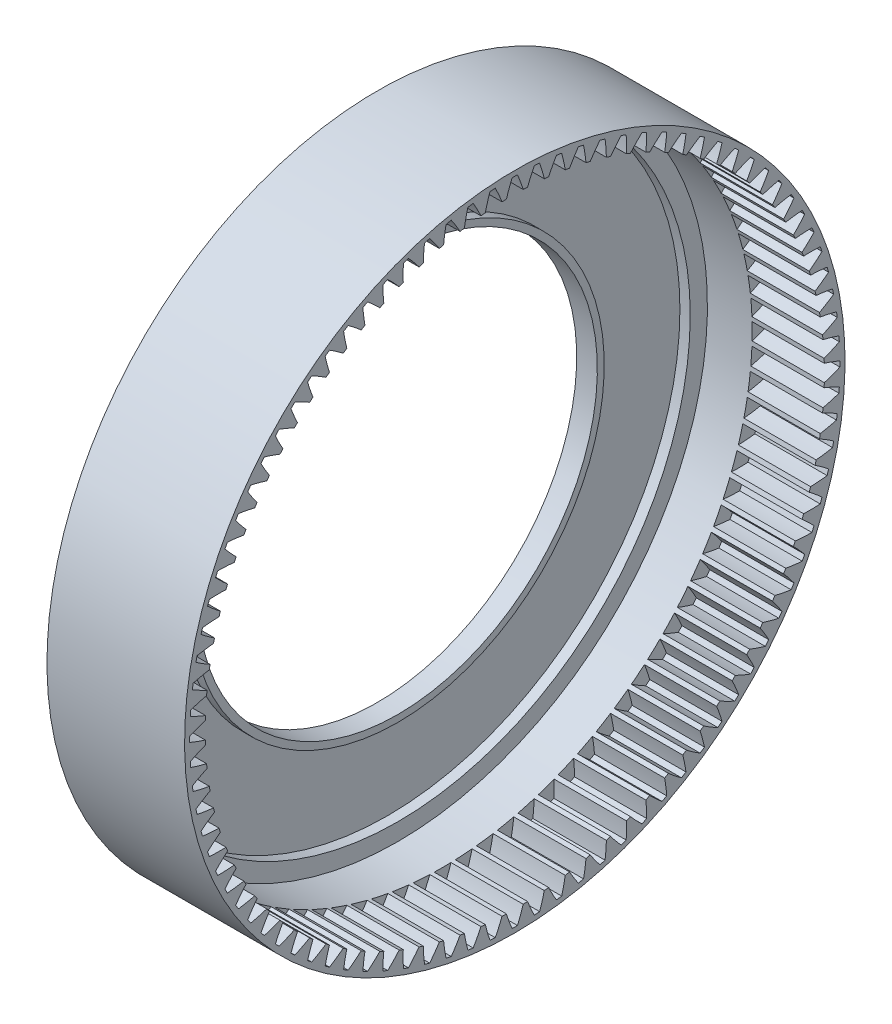
from build123d import *

# Parameters (mm, degrees)
SKETCH1_W                 = 20
SKETCH1_H                 = 48
CUT_EXTRUDE1_DEPTH        = 17
M52_CLEARANCE_HOLE1_D     = 58
M52_CLEARANCE_HOLE1_DEPTH = 20
SKETCH5_R                 = 42.5
SKETCH5_R_2               = 30
CUT_EXTRUDE3_DEPTH        = 1.5
BOSS_EXTRUDE2_START       = 6.5
SKETCH7_R                 = 48
SKETCH7_R_2               = 45
BOSS_EXTRUDE2_DEPTH       = 6.5


with BuildPart() as part:
    # Sketch1 → Revolve1 (revolve)
    with BuildSketch(Plane(origin=(0, 0, 0), x_dir=(-1, 0, 0), z_dir=(0, 0, -1)), mode=Mode.PRIVATE) as revolve1_sk:
        with Locations((-10, 24)):
            Rectangle(SKETCH1_W, SKETCH1_H)
    revolve(revolve1_sk.sketch.rotate(Axis((20, 0, 0), (-1, 0, 0)), 180), axis=Axis((20, 0, 0), (-1, 0, 0)))

    # Sketch2 → Cut-Extrude1 (cut)
    with BuildSketch(Plane(origin=(20, 0, 0), x_dir=(0, 0, -1), z_dir=(1, 0, 0))):
        with BuildLine():
            ThreePointArc((-4.920240464, -44.730204938), (-4.601886702, -44.764077549), (-4.283300013, -44.795684401))
            ThreePointArc((-4.283300013, -44.795684401), (-3.977004226, -45.963131758), (-3.609887733, -47.112903875))
            ThreePointArc((-3.609887733, -47.112903875), (-3.224522274, -47.140847013), (-2.838941206, -47.165638062))
            ThreePointArc((-2.838941206, -47.165638062), (-2.318683439, -46.076564008), (-1.856273113, -44.96169759))
            ThreePointArc((-1.856273113, -44.96169759), (-1.536349958, -44.973766006), (-1.21634904, -44.983558052))
            ThreePointArc((-1.21634904, -44.983558052), (-0.831097875, -46.127381456), (-0.38637399, -47.249420273))
            ThreePointArc((-0.38637399, -47.249420273), (0, -47.251), (0.38637399, -47.249420273))
            ThreePointArc((0.38637399, -47.249420273), (0.831097875, -46.127381456), (1.21634904, -44.983558052))
            ThreePointArc((1.21634904, -44.983558052), (1.536349958, -44.973766006), (1.856273113, -44.96169759))
            ThreePointArc((1.856273113, -44.96169759), (2.318683439, -46.076564008), (2.838941206, -47.165638062))
            ThreePointArc((2.838941206, -47.165638062), (3.224522274, -47.140847013), (3.609887733, -47.112903875))
            ThreePointArc((3.609887733, -47.112903875), (3.977004226, -45.963131758), (4.283300013, -44.795684401))
            ThreePointArc((4.283300013, -44.795684401), (4.601886702, -44.764077549), (4.920240464, -44.730204938))
            ThreePointArc((4.920240464, -44.730204938), (5.45765398, -45.810916349), (6.051019948, -46.861947874))
            ThreePointArc((6.051019948, -46.861947874), (6.434010336, -46.810901636), (6.816570512, -46.756725371))
            ThreePointArc((6.816570512, -46.756725371), (7.104367949, -45.584580723), (7.330280264, -44.398952592))
            ThreePointArc((7.330280264, -44.398952592), (7.645967326, -44.345678297), (7.961267384, -44.290159422))
            ThreePointArc((7.961267384, -44.290159422), (8.571178419, -45.33167705), (9.234886042, -46.339765653))
            ThreePointArc((9.234886042, -46.339765653), (9.613500073, -46.262702227), (9.991471294, -46.18254543))
            ThreePointArc((9.991471294, -46.18254543), (10.198607828, -44.99349333), (10.343083365, -43.79521237))
            ThreePointArc((10.343083365, -43.79521237), (10.654398921, -43.720519023), (10.965175199, -43.643612738))
            ThreePointArc((10.965175199, -43.643612738), (11.644740068, -44.641080547), (12.375694834, -45.601526053))
            ThreePointArc((12.375694834, -45.601526053), (12.748167234, -45.498804744), (13.119787223, -45.393041143))
            ThreePointArc((13.119787223, -45.393041143), (13.24529709, -44.192625501), (13.307662236, -42.987278651))
            ThreePointArc((13.307662236, -42.987278651), (13.61315479, -42.891514507), (13.917958306, -42.793579385))
            ThreePointArc((13.917958306, -42.793579385), (14.664008563, -43.74234672), (15.458802424, -44.650671088))
            ThreePointArc((15.458802424, -44.650671088), (15.823396555, -44.522770831), (16.186932649, -44.391893544))
            ThreePointArc((16.186932649, -44.391893544), (16.230230662, -43.185711252), (16.210194643, -41.978918395))
            ThreePointArc((16.210194643, -41.978918395), (16.508439847, -41.86252995), (16.805849467, -41.744022611))
            ThreePointArc((16.805849467, -41.744022611), (17.614906681, -42.639665879), (18.469833941, -43.491634083))
            ThreePointArc((18.469833941, -43.491634083), (18.824849896, -43.339151207), (19.178607122, -43.183770445))
            ThreePointArc((19.178607122, -43.183770445), (19.139491407, -41.977445281), (19.03714764, -40.774833044))
            ThreePointArc((19.03714764, -40.774833044), (19.326754936, -40.638362955), (19.615383999, -40.499835933))
            ThreePointArc((19.615383999, -40.499835933), (20.483675972, -41.338179233), (21.394750566, -42.129819003))
            ThreePointArc((21.394750566, -42.129819003), (21.738533098, -41.953464455), (22.080862075, -41.774304674))
            ThreePointArc((22.080862075, -41.774304674), (21.959515008, -40.573461083), (21.775340666, -39.380636598))
            ThreePointArc((21.775340666, -39.380636598), (22.054959773, -39.224721151), (22.333462556, -39.066820324))
            ThreePointArc((22.333462556, -39.066820324), (23.256940911, -39.843954913), (24.219914988, -40.571575259))
            ThreePointArc((24.219914988, -40.571575259), (24.550861223, -40.372171284), (24.880165857, -40.170067811))
            ThreePointArc((24.880165857, -40.170067811), (24.677153213, -38.98030468), (24.412007002, -37.802829446))
            ThreePointArc((24.412007002, -37.802829446), (24.680334206, -37.628195591), (24.947412202, -37.451657165))
            ThreePointArc((24.947412202, -37.451657165), (25.921771255, -38.163959683), (26.932154985, -38.824168102))
            ThreePointArc((26.932154985, -38.824168102), (27.2487219, -38.602644415), (27.56346682, -38.378539548))
            ThreePointArc((27.56346682, -38.378539548), (27.279735138, -37.205404103), (26.934853293, -36.048768052))
            ThreePointArc((26.934853293, -36.048768052), (27.190637528, -35.856230014), (27.445045495, -35.661877092))
            ThreePointArc((27.445045495, -35.661877092), (28.465742335, -36.306026455), (29.518824844, -36.895744752))
            ThreePointArc((29.518824844, -36.895744752), (29.819536457, -36.653134197), (30.118254177, -36.408072818))
            ThreePointArc((30.118254177, -36.408072818), (29.755126345, -35.257034757), (29.332116864, -34.126630661))
            ThreePointArc((29.332116864, -34.126630661), (29.574165547, -33.91708614), (29.814717318, -33.705824886))
            ThreePointArc((29.814717318, -33.705824886), (30.876992985, -34.278817773), (31.967864315, -34.795296408))
            ThreePointArc((31.967864315, -34.795296408), (32.25131857, -34.532730148), (32.53261633, -34.267854845))
            ThreePointArc((32.53261633, -34.267854845), (32.091785418, -33.144280839), (31.592620565, -32.045379165))
            ThreePointArc((31.592620565, -32.045379165), (31.819805153, -31.819805153), (32.045379165, -31.592620565))
            ThreePointArc((32.045379165, -31.592620565), (33.144280839, -32.091785418), (34.267854845, -32.53261633))
            ThreePointArc((34.267854845, -32.53261633), (34.532730148, -32.25131857), (34.795296408, -31.967864315))
            ThreePointArc((34.795296408, -31.967864315), (34.278817773, -30.876992985), (33.705824886, -29.814717318))
            ThreePointArc((33.705824886, -29.814717318), (33.91708614, -29.574165547), (34.126630661, -29.332116864))
            ThreePointArc((34.126630661, -29.332116864), (35.257034757, -29.755126345), (36.408072818, -30.118254177))
            ThreePointArc((36.408072818, -30.118254177), (36.653134197, -29.819536457), (36.895744752, -29.518824844))
            ThreePointArc((36.895744752, -29.518824844), (36.306026455, -28.465742335), (35.661877092, -27.445045495))
            ThreePointArc((35.661877092, -27.445045495), (35.856230014, -27.190637528), (36.048768052, -26.934853293))
            ThreePointArc((36.048768052, -26.934853293), (37.205404103, -27.279735138), (38.378539548, -27.56346682))
            ThreePointArc((38.378539548, -27.56346682), (38.602644415, -27.2487219), (38.824168102, -26.932154985))
            ThreePointArc((38.824168102, -26.932154985), (38.163959683, -25.921771255), (37.451657165, -24.947412202))
            ThreePointArc((37.451657165, -24.947412202), (37.628195591, -24.680334206), (37.802829446, -24.412007002))
            ThreePointArc((37.802829446, -24.412007002), (38.98030468, -24.677153213), (40.170067811, -24.880165857))
            ThreePointArc((40.170067811, -24.880165857), (40.372171284, -24.550861223), (40.571575259, -24.219914988))
            ThreePointArc((40.571575259, -24.219914988), (39.843954913, -23.256940911), (39.066820324, -22.333462556))
            ThreePointArc((39.066820324, -22.333462556), (39.224721151, -22.054959773), (39.380636598, -21.775340666))
            ThreePointArc((39.380636598, -21.775340666), (40.573461083, -21.959515008), (41.774304674, -22.080862075))
            ThreePointArc((41.774304674, -22.080862075), (41.953464455, -21.738533098), (42.129819003, -21.394750566))
            ThreePointArc((42.129819003, -21.394750566), (41.338179233, -20.483675972), (40.499835933, -19.615383999))
            ThreePointArc((40.499835933, -19.615383999), (40.638362955, -19.326754936), (40.774833044, -19.03714764))
            ThreePointArc((40.774833044, -19.03714764), (41.977445281, -19.139491407), (43.183770445, -19.178607122))
            ThreePointArc((43.183770445, -19.178607122), (43.339151207, -18.824849896), (43.491634083, -18.469833941))
            ThreePointArc((43.491634083, -18.469833941), (42.639665879, -17.614906681), (41.744022611, -16.805849467))
            ThreePointArc((41.744022611, -16.805849467), (41.86252995, -16.508439847), (41.978918395, -16.210194643))
            ThreePointArc((41.978918395, -16.210194643), (43.185711252, -16.230230662), (44.391893544, -16.186932649))
            ThreePointArc((44.391893544, -16.186932649), (44.522770831, -15.823396555), (44.650671088, -15.458802424))
            ThreePointArc((44.650671088, -15.458802424), (43.74234672, -14.664008563), (42.793579385, -13.917958306))
            ThreePointArc((42.793579385, -13.917958306), (42.891514507, -13.61315479), (42.987278651, -13.307662236))
            ThreePointArc((42.987278651, -13.307662236), (44.192625501, -13.24529709), (45.393041143, -13.119787223))
            ThreePointArc((45.393041143, -13.119787223), (45.498804744, -12.748167234), (45.601526053, -12.375694834))
            ThreePointArc((45.601526053, -12.375694834), (44.641080547, -11.644740068), (43.643612738, -10.965175199))
            ThreePointArc((43.643612738, -10.965175199), (43.720519023, -10.654398921), (43.79521237, -10.343083365))
            ThreePointArc((43.79521237, -10.343083365), (44.99349333, -10.198607828), (46.18254543, -9.991471294))
            ThreePointArc((46.18254543, -9.991471294), (46.262702227, -9.613500073), (46.339765653, -9.234886042))
            ThreePointArc((46.339765653, -9.234886042), (45.33167705, -8.571178419), (44.290159422, -7.961267384))
            ThreePointArc((44.290159422, -7.961267384), (44.345678297, -7.645967326), (44.398952592, -7.330280264))
            ThreePointArc((44.398952592, -7.330280264), (45.584580723, -7.104367949), (46.756725371, -6.816570512))
            ThreePointArc((46.756725371, -6.816570512), (46.810901636, -6.434010336), (46.861947874, -6.051019948))
            ThreePointArc((46.861947874, -6.051019948), (45.810916349, -5.45765398), (44.730204938, -4.920240464))
            ThreePointArc((44.730204938, -4.920240464), (44.764077549, -4.601886702), (44.795684401, -4.283300013))
            ThreePointArc((44.795684401, -4.283300013), (45.963131758, -3.977004226), (47.112903875, -3.609887733))
            ThreePointArc((47.112903875, -3.609887733), (47.140847013, -3.224522274), (47.165638062, -2.838941206))
            ThreePointArc((47.165638062, -2.838941206), (46.076564008, -2.318683439), (44.96169759, -1.856273113))
            ThreePointArc((44.96169759, -1.856273113), (44.973766006, -1.536349958), (44.983558052, -1.21634904))
            ThreePointArc((44.983558052, -1.21634904), (46.127381456, -0.831097875), (47.249420273, -0.38637399))
            ThreePointArc((47.249420273, -0.38637399), (47.251, 0), (47.249420273, 0.38637399))
            ThreePointArc((47.249420273, 0.38637399), (46.127381456, 0.831097875), (44.983558052, 1.21634904))
            ThreePointArc((44.983558052, 1.21634904), (44.973766006, 1.536349958), (44.96169759, 1.856273113))
            ThreePointArc((44.96169759, 1.856273113), (46.076564008, 2.318683439), (47.165638062, 2.838941206))
            ThreePointArc((47.165638062, 2.838941206), (47.140847013, 3.224522274), (47.112903875, 3.609887733))
            ThreePointArc((47.112903875, 3.609887733), (45.963131758, 3.977004226), (44.795684401, 4.283300013))
            ThreePointArc((44.795684401, 4.283300013), (44.764077549, 4.601886702), (44.730204938, 4.920240464))
            ThreePointArc((44.730204938, 4.920240464), (45.810916349, 5.45765398), (46.861947874, 6.051019948))
            ThreePointArc((46.861947874, 6.051019948), (46.810901636, 6.434010336), (46.756725371, 6.816570512))
            ThreePointArc((46.756725371, 6.816570512), (45.584580723, 7.104367949), (44.398952592, 7.330280264))
            ThreePointArc((44.398952592, 7.330280264), (44.345678297, 7.645967326), (44.290159422, 7.961267384))
            ThreePointArc((44.290159422, 7.961267384), (45.33167705, 8.571178419), (46.339765653, 9.234886042))
            ThreePointArc((46.339765653, 9.234886042), (46.262702227, 9.613500073), (46.18254543, 9.991471294))
            ThreePointArc((46.18254543, 9.991471294), (44.99349333, 10.198607828), (43.79521237, 10.343083365))
            ThreePointArc((43.79521237, 10.343083365), (43.720519023, 10.654398921), (43.643612738, 10.965175199))
            ThreePointArc((43.643612738, 10.965175199), (44.641080547, 11.644740068), (45.601526053, 12.375694834))
            ThreePointArc((45.601526053, 12.375694834), (45.498804744, 12.748167234), (45.393041143, 13.119787223))
            ThreePointArc((45.393041143, 13.119787223), (44.192625501, 13.24529709), (42.987278651, 13.307662236))
            ThreePointArc((42.987278651, 13.307662236), (42.891514507, 13.61315479), (42.793579385, 13.917958306))
            ThreePointArc((42.793579385, 13.917958306), (43.74234672, 14.664008563), (44.650671088, 15.458802424))
            ThreePointArc((44.650671088, 15.458802424), (44.522770831, 15.823396555), (44.391893544, 16.186932649))
            ThreePointArc((44.391893544, 16.186932649), (43.185711252, 16.230230662), (41.978918395, 16.210194643))
            ThreePointArc((41.978918395, 16.210194643), (41.86252995, 16.508439847), (41.744022611, 16.805849467))
            ThreePointArc((41.744022611, 16.805849467), (42.639665879, 17.614906681), (43.491634083, 18.469833941))
            ThreePointArc((43.491634083, 18.469833941), (43.339151207, 18.824849896), (43.183770445, 19.178607122))
            ThreePointArc((43.183770445, 19.178607122), (41.977445281, 19.139491407), (40.774833044, 19.03714764))
            ThreePointArc((40.774833044, 19.03714764), (40.638362955, 19.326754936), (40.499835933, 19.615383999))
            ThreePointArc((40.499835933, 19.615383999), (41.338179233, 20.483675972), (42.129819003, 21.394750566))
            ThreePointArc((42.129819003, 21.394750566), (41.953464455, 21.738533098), (41.774304674, 22.080862075))
            ThreePointArc((41.774304674, 22.080862075), (40.573461083, 21.959515008), (39.380636598, 21.775340666))
            ThreePointArc((39.380636598, 21.775340666), (39.224721151, 22.054959773), (39.066820324, 22.333462556))
            ThreePointArc((39.066820324, 22.333462556), (39.843954913, 23.256940911), (40.571575259, 24.219914988))
            ThreePointArc((40.571575259, 24.219914988), (40.372171284, 24.550861223), (40.170067811, 24.880165857))
            ThreePointArc((40.170067811, 24.880165857), (38.98030468, 24.677153213), (37.802829446, 24.412007002))
            ThreePointArc((37.802829446, 24.412007002), (37.628195591, 24.680334206), (37.451657165, 24.947412202))
            ThreePointArc((37.451657165, 24.947412202), (38.163959683, 25.921771255), (38.824168102, 26.932154985))
            ThreePointArc((38.824168102, 26.932154985), (38.602644415, 27.2487219), (38.378539548, 27.56346682))
            ThreePointArc((38.378539548, 27.56346682), (37.205404103, 27.279735138), (36.048768052, 26.934853293))
            ThreePointArc((36.048768052, 26.934853293), (35.856230014, 27.190637528), (35.661877092, 27.445045495))
            ThreePointArc((35.661877092, 27.445045495), (36.306026455, 28.465742335), (36.895744752, 29.518824844))
            ThreePointArc((36.895744752, 29.518824844), (36.653134197, 29.819536457), (36.408072818, 30.118254177))
            ThreePointArc((36.408072818, 30.118254177), (35.257034757, 29.755126345), (34.126630661, 29.332116864))
            ThreePointArc((34.126630661, 29.332116864), (33.91708614, 29.574165547), (33.705824886, 29.814717318))
            ThreePointArc((33.705824886, 29.814717318), (34.278817773, 30.876992985), (34.795296408, 31.967864315))
            ThreePointArc((34.795296408, 31.967864315), (34.532730148, 32.25131857), (34.267854845, 32.53261633))
            ThreePointArc((34.267854845, 32.53261633), (33.144280839, 32.091785418), (32.045379165, 31.592620565))
            ThreePointArc((32.045379165, 31.592620565), (31.819805153, 31.819805153), (31.592620565, 32.045379165))
            ThreePointArc((31.592620565, 32.045379165), (32.091785418, 33.144280839), (32.53261633, 34.267854845))
            ThreePointArc((32.53261633, 34.267854845), (32.25131857, 34.532730148), (31.967864315, 34.795296408))
            ThreePointArc((31.967864315, 34.795296408), (30.876992985, 34.278817773), (29.814717318, 33.705824886))
            ThreePointArc((29.814717318, 33.705824886), (29.574165547, 33.91708614), (29.332116864, 34.126630661))
            ThreePointArc((29.332116864, 34.126630661), (29.755126345, 35.257034757), (30.118254177, 36.408072818))
            ThreePointArc((30.118254177, 36.408072818), (29.819536457, 36.653134197), (29.518824844, 36.895744752))
            ThreePointArc((29.518824844, 36.895744752), (28.465742335, 36.306026455), (27.445045495, 35.661877092))
            ThreePointArc((27.445045495, 35.661877092), (27.190637528, 35.856230014), (26.934853293, 36.048768052))
            ThreePointArc((26.934853293, 36.048768052), (27.279735138, 37.205404103), (27.56346682, 38.378539548))
            ThreePointArc((27.56346682, 38.378539548), (27.2487219, 38.602644415), (26.932154985, 38.824168102))
            ThreePointArc((26.932154985, 38.824168102), (25.921771255, 38.163959683), (24.947412202, 37.451657165))
            ThreePointArc((24.947412202, 37.451657165), (24.680334206, 37.628195591), (24.412007002, 37.802829446))
            ThreePointArc((24.412007002, 37.802829446), (24.677153213, 38.98030468), (24.880165857, 40.170067811))
            ThreePointArc((24.880165857, 40.170067811), (24.550861223, 40.372171284), (24.219914988, 40.571575259))
            ThreePointArc((24.219914988, 40.571575259), (23.256940911, 39.843954913), (22.333462556, 39.066820324))
            ThreePointArc((22.333462556, 39.066820324), (22.054959773, 39.224721151), (21.775340666, 39.380636598))
            ThreePointArc((21.775340666, 39.380636598), (21.959515008, 40.573461083), (22.080862075, 41.774304674))
            ThreePointArc((22.080862075, 41.774304674), (21.738533098, 41.953464455), (21.394750566, 42.129819003))
            ThreePointArc((21.394750566, 42.129819003), (20.483675972, 41.338179233), (19.615383999, 40.499835933))
            ThreePointArc((19.615383999, 40.499835933), (19.326754936, 40.638362955), (19.03714764, 40.774833044))
            ThreePointArc((19.03714764, 40.774833044), (19.139491407, 41.977445281), (19.178607122, 43.183770445))
            ThreePointArc((19.178607122, 43.183770445), (18.824849896, 43.339151207), (18.469833941, 43.491634083))
            ThreePointArc((18.469833941, 43.491634083), (17.614906681, 42.639665879), (16.805849467, 41.744022611))
            ThreePointArc((16.805849467, 41.744022611), (16.508439847, 41.86252995), (16.210194643, 41.978918395))
            ThreePointArc((16.210194643, 41.978918395), (16.230230662, 43.185711252), (16.186932649, 44.391893544))
            ThreePointArc((16.186932649, 44.391893544), (15.823396555, 44.522770831), (15.458802424, 44.650671088))
            ThreePointArc((15.458802424, 44.650671088), (14.664008563, 43.74234672), (13.917958306, 42.793579385))
            ThreePointArc((13.917958306, 42.793579385), (13.61315479, 42.891514507), (13.307662236, 42.987278651))
            ThreePointArc((13.307662236, 42.987278651), (13.24529709, 44.192625501), (13.119787223, 45.393041143))
            ThreePointArc((13.119787223, 45.393041143), (12.748167234, 45.498804744), (12.375694834, 45.601526053))
            ThreePointArc((12.375694834, 45.601526053), (11.644740068, 44.641080547), (10.965175199, 43.643612738))
            ThreePointArc((10.965175199, 43.643612738), (10.654398921, 43.720519023), (10.343083365, 43.79521237))
            ThreePointArc((10.343083365, 43.79521237), (10.198607828, 44.99349333), (9.991471294, 46.18254543))
            ThreePointArc((9.991471294, 46.18254543), (9.613500073, 46.262702227), (9.234886042, 46.339765653))
            ThreePointArc((9.234886042, 46.339765653), (8.571178419, 45.33167705), (7.961267384, 44.290159422))
            ThreePointArc((7.961267384, 44.290159422), (7.645967326, 44.345678297), (7.330280264, 44.398952592))
            ThreePointArc((7.330280264, 44.398952592), (7.104367949, 45.584580723), (6.816570512, 46.756725371))
            ThreePointArc((6.816570512, 46.756725371), (6.434010336, 46.810901636), (6.051019948, 46.861947874))
            ThreePointArc((6.051019948, 46.861947874), (5.45765398, 45.810916349), (4.920240464, 44.730204938))
            ThreePointArc((4.920240464, 44.730204938), (4.601886702, 44.764077549), (4.283300013, 44.795684401))
            ThreePointArc((4.283300013, 44.795684401), (3.977004226, 45.963131758), (3.609887733, 47.112903875))
            ThreePointArc((3.609887733, 47.112903875), (3.224522274, 47.140847013), (2.838941206, 47.165638062))
            ThreePointArc((2.838941206, 47.165638062), (2.318683439, 46.076564008), (1.856273113, 44.96169759))
            ThreePointArc((1.856273113, 44.96169759), (1.536349958, 44.973766006), (1.21634904, 44.983558052))
            ThreePointArc((1.21634904, 44.983558052), (0.831097875, 46.127381456), (0.38637399, 47.249420273))
            ThreePointArc((0.38637399, 47.249420273), (0, 47.251), (-0.38637399, 47.249420273))
            ThreePointArc((-0.38637399, 47.249420273), (-0.831097875, 46.127381456), (-1.21634904, 44.983558052))
            ThreePointArc((-1.21634904, 44.983558052), (-1.536349958, 44.973766006), (-1.856273113, 44.96169759))
            ThreePointArc((-1.856273113, 44.96169759), (-2.318683439, 46.076564008), (-2.838941206, 47.165638062))
            ThreePointArc((-2.838941206, 47.165638062), (-3.224522274, 47.140847013), (-3.609887733, 47.112903875))
            ThreePointArc((-3.609887733, 47.112903875), (-3.977004226, 45.963131758), (-4.283300013, 44.795684401))
            ThreePointArc((-4.283300013, 44.795684401), (-4.601886702, 44.764077549), (-4.920240464, 44.730204938))
            ThreePointArc((-4.920240464, 44.730204938), (-5.45765398, 45.810916349), (-6.051019948, 46.861947874))
            ThreePointArc((-6.051019948, 46.861947874), (-6.434010336, 46.810901636), (-6.816570512, 46.756725371))
            ThreePointArc((-6.816570512, 46.756725371), (-7.104367949, 45.584580723), (-7.330280264, 44.398952592))
            ThreePointArc((-7.330280264, 44.398952592), (-7.645967326, 44.345678297), (-7.961267384, 44.290159422))
            ThreePointArc((-7.961267384, 44.290159422), (-8.571178419, 45.33167705), (-9.234886042, 46.339765653))
            ThreePointArc((-9.234886042, 46.339765653), (-9.613500073, 46.262702227), (-9.991471294, 46.18254543))
            ThreePointArc((-9.991471294, 46.18254543), (-10.198607828, 44.99349333), (-10.343083365, 43.79521237))
            ThreePointArc((-10.343083365, 43.79521237), (-10.654398921, 43.720519023), (-10.965175199, 43.643612738))
            ThreePointArc((-10.965175199, 43.643612738), (-11.644740068, 44.641080547), (-12.375694834, 45.601526053))
            ThreePointArc((-12.375694834, 45.601526053), (-12.748167234, 45.498804744), (-13.119787223, 45.393041143))
            ThreePointArc((-13.119787223, 45.393041143), (-13.24529709, 44.192625501), (-13.307662236, 42.987278651))
            ThreePointArc((-13.307662236, 42.987278651), (-13.61315479, 42.891514507), (-13.917958306, 42.793579385))
            ThreePointArc((-13.917958306, 42.793579385), (-14.664008563, 43.74234672), (-15.458802424, 44.650671088))
            ThreePointArc((-15.458802424, 44.650671088), (-15.823396555, 44.522770831), (-16.186932649, 44.391893544))
            ThreePointArc((-16.186932649, 44.391893544), (-16.230230662, 43.185711252), (-16.210194643, 41.978918395))
            ThreePointArc((-16.210194643, 41.978918395), (-16.508439847, 41.86252995), (-16.805849467, 41.744022611))
            ThreePointArc((-16.805849467, 41.744022611), (-17.614906681, 42.639665879), (-18.469833941, 43.491634083))
            ThreePointArc((-18.469833941, 43.491634083), (-18.824849896, 43.339151207), (-19.178607122, 43.183770445))
            ThreePointArc((-19.178607122, 43.183770445), (-19.139491407, 41.977445281), (-19.03714764, 40.774833044))
            ThreePointArc((-19.03714764, 40.774833044), (-19.326754936, 40.638362955), (-19.615383999, 40.499835933))
            ThreePointArc((-19.615383999, 40.499835933), (-20.483675972, 41.338179233), (-21.394750566, 42.129819003))
            ThreePointArc((-21.394750566, 42.129819003), (-21.738533098, 41.953464455), (-22.080862075, 41.774304674))
            ThreePointArc((-22.080862075, 41.774304674), (-21.959515008, 40.573461083), (-21.775340666, 39.380636598))
            ThreePointArc((-21.775340666, 39.380636598), (-22.054959773, 39.224721151), (-22.333462556, 39.066820324))
            ThreePointArc((-22.333462556, 39.066820324), (-23.256940911, 39.843954913), (-24.219914988, 40.571575259))
            ThreePointArc((-24.219914988, 40.571575259), (-24.550861223, 40.372171284), (-24.880165857, 40.170067811))
            ThreePointArc((-24.880165857, 40.170067811), (-24.677153213, 38.98030468), (-24.412007002, 37.802829446))
            ThreePointArc((-24.412007002, 37.802829446), (-24.680334206, 37.628195591), (-24.947412202, 37.451657165))
            ThreePointArc((-24.947412202, 37.451657165), (-25.921771255, 38.163959683), (-26.932154985, 38.824168102))
            ThreePointArc((-26.932154985, 38.824168102), (-27.2487219, 38.602644415), (-27.56346682, 38.378539548))
            ThreePointArc((-27.56346682, 38.378539548), (-27.279735138, 37.205404103), (-26.934853293, 36.048768052))
            ThreePointArc((-26.934853293, 36.048768052), (-27.190637528, 35.856230014), (-27.445045495, 35.661877092))
            ThreePointArc((-27.445045495, 35.661877092), (-28.465742335, 36.306026455), (-29.518824844, 36.895744752))
            ThreePointArc((-29.518824844, 36.895744752), (-29.819536457, 36.653134197), (-30.118254177, 36.408072818))
            ThreePointArc((-30.118254177, 36.408072818), (-29.755126345, 35.257034757), (-29.332116864, 34.126630661))
            ThreePointArc((-29.332116864, 34.126630661), (-29.574165547, 33.91708614), (-29.814717318, 33.705824886))
            ThreePointArc((-29.814717318, 33.705824886), (-30.876992985, 34.278817773), (-31.967864315, 34.795296408))
            ThreePointArc((-31.967864315, 34.795296408), (-32.25131857, 34.532730148), (-32.53261633, 34.267854845))
            ThreePointArc((-32.53261633, 34.267854845), (-32.091785418, 33.144280839), (-31.592620565, 32.045379165))
            ThreePointArc((-31.592620565, 32.045379165), (-31.819805153, 31.819805153), (-32.045379165, 31.592620565))
            ThreePointArc((-32.045379165, 31.592620565), (-33.144280839, 32.091785418), (-34.267854845, 32.53261633))
            ThreePointArc((-34.267854845, 32.53261633), (-34.532730148, 32.25131857), (-34.795296408, 31.967864315))
            ThreePointArc((-34.795296408, 31.967864315), (-34.278817773, 30.876992985), (-33.705824886, 29.814717318))
            ThreePointArc((-33.705824886, 29.814717318), (-33.91708614, 29.574165547), (-34.126630661, 29.332116864))
            ThreePointArc((-34.126630661, 29.332116864), (-35.257034757, 29.755126345), (-36.408072818, 30.118254177))
            ThreePointArc((-36.408072818, 30.118254177), (-36.653134197, 29.819536457), (-36.895744752, 29.518824844))
            ThreePointArc((-36.895744752, 29.518824844), (-36.306026455, 28.465742335), (-35.661877092, 27.445045495))
            ThreePointArc((-35.661877092, 27.445045495), (-35.856230014, 27.190637528), (-36.048768052, 26.934853293))
            ThreePointArc((-36.048768052, 26.934853293), (-37.205404103, 27.279735138), (-38.378539548, 27.56346682))
            ThreePointArc((-38.378539548, 27.56346682), (-38.602644415, 27.2487219), (-38.824168102, 26.932154985))
            ThreePointArc((-38.824168102, 26.932154985), (-38.163959683, 25.921771255), (-37.451657165, 24.947412202))
            ThreePointArc((-37.451657165, 24.947412202), (-37.628195591, 24.680334206), (-37.802829446, 24.412007002))
            ThreePointArc((-37.802829446, 24.412007002), (-38.98030468, 24.677153213), (-40.170067811, 24.880165857))
            ThreePointArc((-40.170067811, 24.880165857), (-40.372171284, 24.550861223), (-40.571575259, 24.219914988))
            ThreePointArc((-40.571575259, 24.219914988), (-39.843954913, 23.256940911), (-39.066820324, 22.333462556))
            ThreePointArc((-39.066820324, 22.333462556), (-39.224721151, 22.054959773), (-39.380636598, 21.775340666))
            ThreePointArc((-39.380636598, 21.775340666), (-40.573461083, 21.959515008), (-41.774304674, 22.080862075))
            ThreePointArc((-41.774304674, 22.080862075), (-41.953464455, 21.738533098), (-42.129819003, 21.394750566))
            ThreePointArc((-42.129819003, 21.394750566), (-41.338179233, 20.483675972), (-40.499835933, 19.615383999))
            ThreePointArc((-40.499835933, 19.615383999), (-40.638362955, 19.326754936), (-40.774833044, 19.03714764))
            ThreePointArc((-40.774833044, 19.03714764), (-41.977445281, 19.139491407), (-43.183770445, 19.178607122))
            ThreePointArc((-43.183770445, 19.178607122), (-43.339151207, 18.824849896), (-43.491634083, 18.469833941))
            ThreePointArc((-43.491634083, 18.469833941), (-42.639665879, 17.614906681), (-41.744022611, 16.805849467))
            ThreePointArc((-41.744022611, 16.805849467), (-41.86252995, 16.508439847), (-41.978918395, 16.210194643))
            ThreePointArc((-41.978918395, 16.210194643), (-43.185711252, 16.230230662), (-44.391893544, 16.186932649))
            ThreePointArc((-44.391893544, 16.186932649), (-44.522770831, 15.823396555), (-44.650671088, 15.458802424))
            ThreePointArc((-44.650671088, 15.458802424), (-43.74234672, 14.664008563), (-42.793579385, 13.917958306))
            ThreePointArc((-42.793579385, 13.917958306), (-42.891514507, 13.61315479), (-42.987278651, 13.307662236))
            ThreePointArc((-42.987278651, 13.307662236), (-44.192625501, 13.24529709), (-45.393041143, 13.119787223))
            ThreePointArc((-45.393041143, 13.119787223), (-45.498804744, 12.748167234), (-45.601526053, 12.375694834))
            ThreePointArc((-45.601526053, 12.375694834), (-44.641080547, 11.644740068), (-43.643612738, 10.965175199))
            ThreePointArc((-43.643612738, 10.965175199), (-43.720519023, 10.654398921), (-43.79521237, 10.343083365))
            ThreePointArc((-43.79521237, 10.343083365), (-44.99349333, 10.198607828), (-46.18254543, 9.991471294))
            ThreePointArc((-46.18254543, 9.991471294), (-46.262702227, 9.613500073), (-46.339765653, 9.234886042))
            ThreePointArc((-46.339765653, 9.234886042), (-45.33167705, 8.571178419), (-44.290159422, 7.961267384))
            ThreePointArc((-44.290159422, 7.961267384), (-44.345678297, 7.645967326), (-44.398952592, 7.330280264))
            ThreePointArc((-44.398952592, 7.330280264), (-45.584580723, 7.104367949), (-46.756725371, 6.816570512))
            ThreePointArc((-46.756725371, 6.816570512), (-46.810901636, 6.434010336), (-46.861947874, 6.051019948))
            ThreePointArc((-46.861947874, 6.051019948), (-45.810916349, 5.45765398), (-44.730204938, 4.920240464))
            ThreePointArc((-44.730204938, 4.920240464), (-44.764077549, 4.601886702), (-44.795684401, 4.283300013))
            ThreePointArc((-44.795684401, 4.283300013), (-45.963131758, 3.977004226), (-47.112903875, 3.609887733))
            ThreePointArc((-47.112903875, 3.609887733), (-47.140847013, 3.224522274), (-47.165638062, 2.838941206))
            ThreePointArc((-47.165638062, 2.838941206), (-46.076564008, 2.318683439), (-44.96169759, 1.856273113))
            ThreePointArc((-44.96169759, 1.856273113), (-44.973766006, 1.536349958), (-44.983558052, 1.21634904))
            ThreePointArc((-44.983558052, 1.21634904), (-46.127381456, 0.831097875), (-47.249420273, 0.38637399))
            ThreePointArc((-47.249420273, 0.38637399), (-47.251, 0), (-47.249420273, -0.38637399))
            ThreePointArc((-47.249420273, -0.38637399), (-46.127381456, -0.831097875), (-44.983558052, -1.21634904))
            ThreePointArc((-44.983558052, -1.21634904), (-44.973766006, -1.536349958), (-44.96169759, -1.856273113))
            ThreePointArc((-44.96169759, -1.856273113), (-46.076564008, -2.318683439), (-47.165638062, -2.838941206))
            ThreePointArc((-47.165638062, -2.838941206), (-47.140847013, -3.224522274), (-47.112903875, -3.609887733))
            ThreePointArc((-47.112903875, -3.609887733), (-45.963131758, -3.977004226), (-44.795684401, -4.283300013))
            ThreePointArc((-44.795684401, -4.283300013), (-44.764077549, -4.601886702), (-44.730204938, -4.920240464))
            ThreePointArc((-44.730204938, -4.920240464), (-45.810916349, -5.45765398), (-46.861947874, -6.051019948))
            ThreePointArc((-46.861947874, -6.051019948), (-46.810901636, -6.434010336), (-46.756725371, -6.816570512))
            ThreePointArc((-46.756725371, -6.816570512), (-45.584580723, -7.104367949), (-44.398952592, -7.330280264))
            ThreePointArc((-44.398952592, -7.330280264), (-44.345678297, -7.645967326), (-44.290159422, -7.961267384))
            ThreePointArc((-44.290159422, -7.961267384), (-45.33167705, -8.571178419), (-46.339765653, -9.234886042))
            ThreePointArc((-46.339765653, -9.234886042), (-46.262702227, -9.613500073), (-46.18254543, -9.991471294))
            ThreePointArc((-46.18254543, -9.991471294), (-44.99349333, -10.198607828), (-43.79521237, -10.343083365))
            ThreePointArc((-43.79521237, -10.343083365), (-43.720519023, -10.654398921), (-43.643612738, -10.965175199))
            ThreePointArc((-43.643612738, -10.965175199), (-44.641080547, -11.644740068), (-45.601526053, -12.375694834))
            ThreePointArc((-45.601526053, -12.375694834), (-45.498804744, -12.748167234), (-45.393041143, -13.119787223))
            ThreePointArc((-45.393041143, -13.119787223), (-44.192625501, -13.24529709), (-42.987278651, -13.307662236))
            ThreePointArc((-42.987278651, -13.307662236), (-42.891514507, -13.61315479), (-42.793579385, -13.917958306))
            ThreePointArc((-42.793579385, -13.917958306), (-43.74234672, -14.664008563), (-44.650671088, -15.458802424))
            ThreePointArc((-44.650671088, -15.458802424), (-44.522770831, -15.823396555), (-44.391893544, -16.186932649))
            ThreePointArc((-44.391893544, -16.186932649), (-43.185711252, -16.230230662), (-41.978918395, -16.210194643))
            ThreePointArc((-41.978918395, -16.210194643), (-41.86252995, -16.508439847), (-41.744022611, -16.805849467))
            ThreePointArc((-41.744022611, -16.805849467), (-42.639665879, -17.614906681), (-43.491634083, -18.469833941))
            ThreePointArc((-43.491634083, -18.469833941), (-43.339151207, -18.824849896), (-43.183770445, -19.178607122))
            ThreePointArc((-43.183770445, -19.178607122), (-41.977445281, -19.139491407), (-40.774833044, -19.03714764))
            ThreePointArc((-40.774833044, -19.03714764), (-40.638362955, -19.326754936), (-40.499835933, -19.615383999))
            ThreePointArc((-40.499835933, -19.615383999), (-41.338179233, -20.483675972), (-42.129819003, -21.394750566))
            ThreePointArc((-42.129819003, -21.394750566), (-41.953464455, -21.738533098), (-41.774304674, -22.080862075))
            ThreePointArc((-41.774304674, -22.080862075), (-40.573461083, -21.959515008), (-39.380636598, -21.775340666))
            ThreePointArc((-39.380636598, -21.775340666), (-39.224721151, -22.054959773), (-39.066820324, -22.333462556))
            ThreePointArc((-39.066820324, -22.333462556), (-39.843954913, -23.256940911), (-40.571575259, -24.219914988))
            ThreePointArc((-40.571575259, -24.219914988), (-40.372171284, -24.550861223), (-40.170067811, -24.880165857))
            ThreePointArc((-40.170067811, -24.880165857), (-38.98030468, -24.677153213), (-37.802829446, -24.412007002))
            ThreePointArc((-37.802829446, -24.412007002), (-37.628195591, -24.680334206), (-37.451657165, -24.947412202))
            ThreePointArc((-37.451657165, -24.947412202), (-38.163959683, -25.921771255), (-38.824168102, -26.932154985))
            ThreePointArc((-38.824168102, -26.932154985), (-38.602644415, -27.2487219), (-38.378539548, -27.56346682))
            ThreePointArc((-38.378539548, -27.56346682), (-37.205404103, -27.279735138), (-36.048768052, -26.934853293))
            ThreePointArc((-36.048768052, -26.934853293), (-35.856230014, -27.190637528), (-35.661877092, -27.445045495))
            ThreePointArc((-35.661877092, -27.445045495), (-36.306026455, -28.465742335), (-36.895744752, -29.518824844))
            ThreePointArc((-36.895744752, -29.518824844), (-36.653134197, -29.819536457), (-36.408072818, -30.118254177))
            ThreePointArc((-36.408072818, -30.118254177), (-35.257034757, -29.755126345), (-34.126630661, -29.332116864))
            ThreePointArc((-34.126630661, -29.332116864), (-33.91708614, -29.574165547), (-33.705824886, -29.814717318))
            ThreePointArc((-33.705824886, -29.814717318), (-34.278817773, -30.876992985), (-34.795296408, -31.967864315))
            ThreePointArc((-34.795296408, -31.967864315), (-34.532730148, -32.25131857), (-34.267854845, -32.53261633))
            ThreePointArc((-34.267854845, -32.53261633), (-33.144280839, -32.091785418), (-32.045379165, -31.592620565))
            ThreePointArc((-32.045379165, -31.592620565), (-31.819805153, -31.819805153), (-31.592620565, -32.045379165))
            ThreePointArc((-31.592620565, -32.045379165), (-32.091785418, -33.144280839), (-32.53261633, -34.267854845))
            ThreePointArc((-32.53261633, -34.267854845), (-32.25131857, -34.532730148), (-31.967864315, -34.795296408))
            ThreePointArc((-31.967864315, -34.795296408), (-30.876992985, -34.278817773), (-29.814717318, -33.705824886))
            ThreePointArc((-29.814717318, -33.705824886), (-29.574165547, -33.91708614), (-29.332116864, -34.126630661))
            ThreePointArc((-29.332116864, -34.126630661), (-29.755126345, -35.257034757), (-30.118254177, -36.408072818))
            ThreePointArc((-30.118254177, -36.408072818), (-29.819536457, -36.653134197), (-29.518824844, -36.895744752))
            ThreePointArc((-29.518824844, -36.895744752), (-28.465742335, -36.306026455), (-27.445045495, -35.661877092))
            ThreePointArc((-27.445045495, -35.661877092), (-27.190637528, -35.856230014), (-26.934853293, -36.048768052))
            ThreePointArc((-26.934853293, -36.048768052), (-27.279735138, -37.205404103), (-27.56346682, -38.378539548))
            ThreePointArc((-27.56346682, -38.378539548), (-27.2487219, -38.602644415), (-26.932154985, -38.824168102))
            ThreePointArc((-26.932154985, -38.824168102), (-25.921771255, -38.163959683), (-24.947412202, -37.451657165))
            ThreePointArc((-24.947412202, -37.451657165), (-24.680334206, -37.628195591), (-24.412007002, -37.802829446))
            ThreePointArc((-24.412007002, -37.802829446), (-24.677153213, -38.98030468), (-24.880165857, -40.170067811))
            ThreePointArc((-24.880165857, -40.170067811), (-24.550861223, -40.372171284), (-24.219914988, -40.571575259))
            ThreePointArc((-24.219914988, -40.571575259), (-23.256940911, -39.843954913), (-22.333462556, -39.066820324))
            ThreePointArc((-22.333462556, -39.066820324), (-22.054959773, -39.224721151), (-21.775340666, -39.380636598))
            ThreePointArc((-21.775340666, -39.380636598), (-21.959515008, -40.573461083), (-22.080862075, -41.774304674))
            ThreePointArc((-22.080862075, -41.774304674), (-21.738533098, -41.953464455), (-21.394750566, -42.129819003))
            ThreePointArc((-21.394750566, -42.129819003), (-20.483675972, -41.338179233), (-19.615383999, -40.499835933))
            ThreePointArc((-19.615383999, -40.499835933), (-19.326754936, -40.638362955), (-19.03714764, -40.774833044))
            ThreePointArc((-19.03714764, -40.774833044), (-19.139491407, -41.977445281), (-19.178607122, -43.183770445))
            ThreePointArc((-19.178607122, -43.183770445), (-18.824849896, -43.339151207), (-18.469833941, -43.491634083))
            ThreePointArc((-18.469833941, -43.491634083), (-17.614906681, -42.639665879), (-16.805849467, -41.744022611))
            ThreePointArc((-16.805849467, -41.744022611), (-16.508439847, -41.86252995), (-16.210194643, -41.978918395))
            ThreePointArc((-16.210194643, -41.978918395), (-16.230230662, -43.185711252), (-16.186932649, -44.391893544))
            ThreePointArc((-16.186932649, -44.391893544), (-15.823396555, -44.522770831), (-15.458802424, -44.650671088))
            ThreePointArc((-15.458802424, -44.650671088), (-14.664008563, -43.74234672), (-13.917958306, -42.793579385))
            ThreePointArc((-13.917958306, -42.793579385), (-13.61315479, -42.891514507), (-13.307662236, -42.987278651))
            ThreePointArc((-13.307662236, -42.987278651), (-13.24529709, -44.192625501), (-13.119787223, -45.393041143))
            ThreePointArc((-13.119787223, -45.393041143), (-12.748167234, -45.498804744), (-12.375694834, -45.601526053))
            ThreePointArc((-12.375694834, -45.601526053), (-11.644740068, -44.641080547), (-10.965175199, -43.643612738))
            ThreePointArc((-10.965175199, -43.643612738), (-10.654398921, -43.720519023), (-10.343083365, -43.79521237))
            ThreePointArc((-10.343083365, -43.79521237), (-10.198607828, -44.99349333), (-9.991471294, -46.18254543))
            ThreePointArc((-9.991471294, -46.18254543), (-9.613500073, -46.262702227), (-9.234886042, -46.339765653))
            ThreePointArc((-9.234886042, -46.339765653), (-8.571178419, -45.33167705), (-7.961267384, -44.290159422))
            ThreePointArc((-7.961267384, -44.290159422), (-7.645967326, -44.345678297), (-7.330280264, -44.398952592))
            ThreePointArc((-7.330280264, -44.398952592), (-7.104367949, -45.584580723), (-6.816570512, -46.756725371))
            ThreePointArc((-6.816570512, -46.756725371), (-6.434010336, -46.810901636), (-6.051019948, -46.861947874))
            ThreePointArc((-6.051019948, -46.861947874), (-5.45765398, -45.810916349), (-4.920240464, -44.730204938))
        make_face()
    extrude(amount=-CUT_EXTRUDE1_DEPTH, mode=Mode.SUBTRACT)

    # M52 Clearance Hole1
    with Locations(Plane.ZY):
        with Locations((0, 0)):
            Hole(M52_CLEARANCE_HOLE1_D / 2, depth=M52_CLEARANCE_HOLE1_DEPTH)

    # Sketch5 → Cut-Extrude3 (cut)
    with BuildSketch(Plane.ZY.offset(-3)):
        with Locations(Location((0, 0, 0), (0, 0, 270))):
            Circle(SKETCH5_R)
        with Locations(Location((0, 0, 0), (0, 0, 270))):
            Circle(SKETCH5_R_2, mode=Mode.SUBTRACT)
    extrude(amount=CUT_EXTRUDE3_DEPTH, mode=Mode.SUBTRACT)

    # Sketch7 → Boss-Extrude2 (add)
    with BuildSketch(Plane(origin=(3, 0, 0), x_dir=(0, 0, -1), z_dir=(1, 0, 0)).offset(BOSS_EXTRUDE2_START)):
        with Locations(Location((0, 0, 0), (0, 0, 270))):
            Circle(SKETCH7_R)
        with Locations(Location((0, 0, 0), (0, 0, 358.451107654))):
            Circle(SKETCH7_R_2, mode=Mode.SUBTRACT)
    extrude(amount=-BOSS_EXTRUDE2_DEPTH)


solid = part.part
